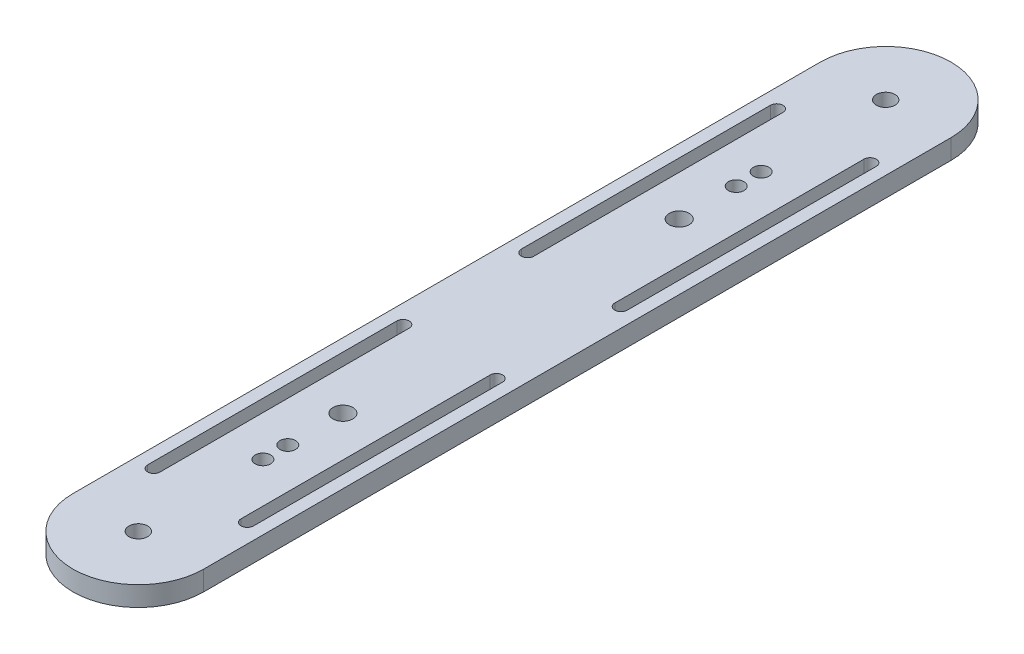
from build123d import *

# Parameters (mm, degrees)
SKETCH1_R               = 1.5
BOSS_EXTRUDE1_DEPTH     = 3.175
CUT_EXTRUDE1_DEPTH      = 131.960225355
CUT_EXTRUDE1_DEPTH_BACK = 131.960225355
CUT_EXTRUDE2_DEPTH      = 131.960225355
CUT_EXTRUDE2_DEPTH_BACK = 131.960225355
CUT_EXTRUDE3_DEPTH      = 131.960225355
CUT_EXTRUDE3_DEPTH_BACK = 131.960225355
SKETCH4_R               = 1.6
CUT_EXTRUDE4_DEPTH      = 40


with BuildPart() as part:
    # Sketch1 → Boss-Extrude1 (new body)
    with BuildSketch(Plane(origin=(0, 0, 0), x_dir=(1, 0, 0), z_dir=(0, 1, 0))):
        with BuildLine():
            Line((-10.5, 0), (-10.5, -120))
            ThreePointArc((-10.5, -120), (0, -130.5), (10.5, -120))
            Line((10.5, -120), (10.5, 0))
            ThreePointArc((10.5, 0), (0, 10.5), (-10.5, 0))
        make_face()
        Circle(SKETCH1_R, mode=Mode.SUBTRACT)
        with Locations((0, -120)):
            Circle(SKETCH1_R, mode=Mode.SUBTRACT)
    extrude(amount=BOSS_EXTRUDE1_DEPTH)

    # Sketch2 → Cut-Extrude1 (cut, two sides: drawn at the far end of the back side and taken through both)
    with BuildSketch(Plane.XZ.offset(-CUT_EXTRUDE1_DEPTH_BACK)):
        with BuildLine():
            ThreePointArc((0, 18.75), (1.25, 20), (0, 21.25))
            ThreePointArc((0, 21.25), (-1.25, 20), (0, 18.75))
        make_face()
        with BuildLine():
            ThreePointArc((0, 25.25), (-1.25, 24), (0, 22.75))
            ThreePointArc((0, 22.75), (1.25, 24), (0, 25.25))
        make_face()
    extrude(amount=CUT_EXTRUDE1_DEPTH + CUT_EXTRUDE1_DEPTH_BACK, mode=Mode.SUBTRACT)

    # Sketch3 → Cut-Extrude2 (cut, two sides: drawn at the far end of the back side and taken through both)
    with BuildSketch(Plane(origin=(0, 3.175, 0), x_dir=(1, 0, 0), z_dir=(0, 1, 0)).offset(-CUT_EXTRUDE2_DEPTH_BACK)):
        with BuildLine():
            ThreePointArc((0, -97.25), (1.25, -96), (0, -94.75))
            ThreePointArc((0, -94.75), (-1.25, -96), (0, -97.25))
        make_face()
        with BuildLine():
            ThreePointArc((0, -98.75), (-1.25, -100), (0, -101.25))
            ThreePointArc((0, -101.25), (1.25, -100), (0, -98.75))
        make_face()
    extrude(amount=CUT_EXTRUDE2_DEPTH + CUT_EXTRUDE2_DEPTH_BACK, mode=Mode.SUBTRACT)

    # Sketch4 → Cut-Extrude3 (cut, two sides: drawn at the far end of the back side and taken through both)
    with BuildSketch(Plane(origin=(0, 3.175, 0), x_dir=(1, 0, 0), z_dir=(0, 1, 0)).offset(-CUT_EXTRUDE3_DEPTH_BACK)):
        with Locations((0, -33.15)):
            Circle(SKETCH4_R)
        with Locations((0, -87.15)):
            Circle(SKETCH4_R)
    extrude(amount=CUT_EXTRUDE3_DEPTH + CUT_EXTRUDE3_DEPTH_BACK, mode=Mode.SUBTRACT)

    # Sketch5 → Cut-Extrude4 (cut)
    with BuildSketch(Plane.XZ):
        with BuildLine():
            Line((-8.5, 10), (-8.5, 50))
            ThreePointArc((-8.5, 50), (-7.5, 51), (-6.5, 50))
            Line((-6.5, 50), (-6.5, 10))
            ThreePointArc((-6.5, 10), (-7.5, 9), (-8.5, 10))
        make_face()
        with BuildLine():
            Line((6.5, 50), (6.5, 10))
            ThreePointArc((6.5, 10), (7.5, 9), (8.5, 10))
            Line((8.5, 10), (8.5, 50))
            ThreePointArc((8.5, 50), (7.5, 51), (6.5, 50))
        make_face()
        with BuildLine():
            Line((8.5, 110), (8.5, 70))
            ThreePointArc((8.5, 70), (7.5, 69), (6.5, 70))
            Line((6.5, 70), (6.5, 110))
            ThreePointArc((6.5, 110), (7.5, 111), (8.5, 110))
        make_face()
        with BuildLine():
            Line((-6.5, 70), (-6.5, 110))
            ThreePointArc((-6.5, 110), (-7.5, 111), (-8.5, 110))
            Line((-8.5, 110), (-8.5, 70))
            ThreePointArc((-8.5, 70), (-7.5, 69), (-6.5, 70))
        make_face()
    extrude(amount=-CUT_EXTRUDE4_DEPTH, mode=Mode.SUBTRACT)


solid = part.part
